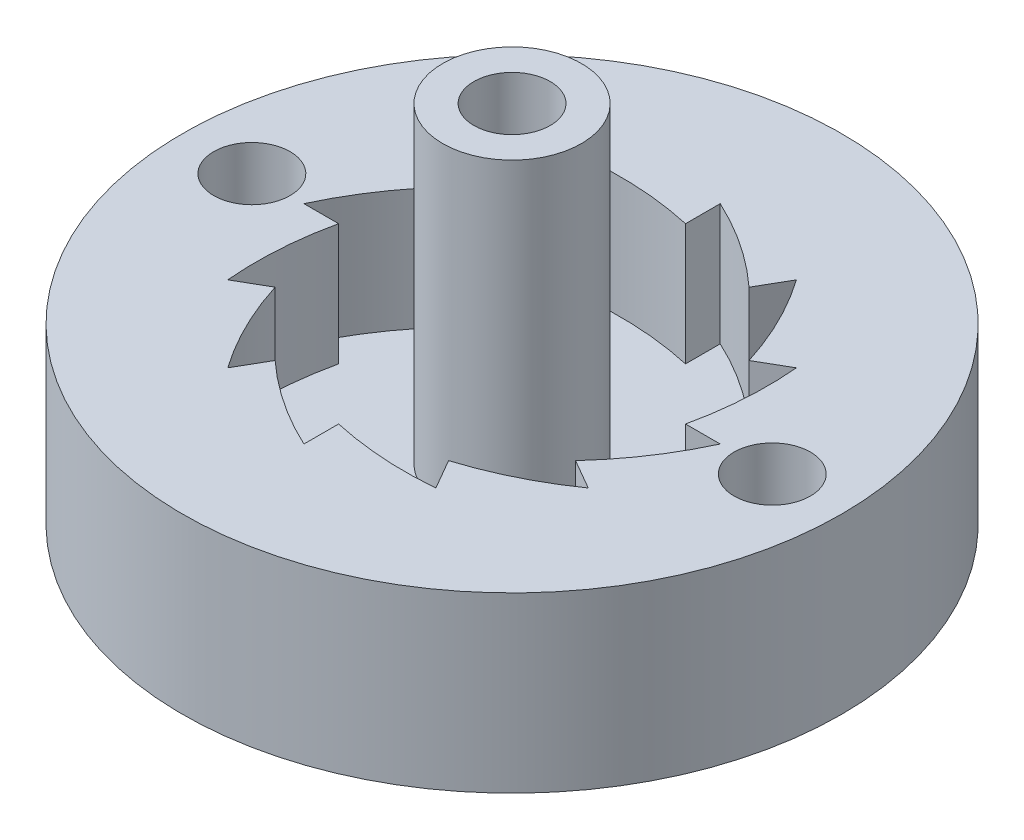
from build123d import *

# Parameters (mm, degrees)
SIDE_PROFILE_RATCHETING_PULLEY_MASTERMOD_W = 7.5
SIDE_PROFILE_RATCHETING_PULLEY_MASTERMOD_H = 5
RATCHETING_START                           = 1.5
RATCHETING_PULLEY_MASTERMODEL_OUTLINE_R    = 6
RATCHETING_PULLEY_MASTERMODEL_OUTLINE_R_2  = 2
RATCHETING_PULLEY_MASTERMODEL_DEPTH        = 3.5
M2_CLEARANCE_HOLE2_D                       = 2.2
BOSS_EXTRUDE2_DEPTH                        = 5
BOSS_EXTRUDE1_START                        = 10.5
BOTTOM_PULLEY_RATCHETING_PULLEY_MASTERMO_R = 2
BOSS_EXTRUDE1_DEPTH                        = 10.5
M2_CLEARANCE_HOLE3_D                       = 2.2
BOTTOM_PULLEY_RATCHETING_PULLEY_MAST_2_R   = 4
CUT_EXTRUDE3_DEPTH                         = 1


# Read off the part's stored shape, not the designer's step: ratcheting pulley mastermodel
with BuildPart() as part:
    # side profile-ratcheting pulley mastermod → Revolve1 (revolve)
    with BuildSketch(Plane.XY, mode=Mode.PRIVATE) as revolve1_sk:
        with Locations((-5.75, 2.5)):
            Rectangle(SIDE_PROFILE_RATCHETING_PULLEY_MASTERMOD_W, SIDE_PROFILE_RATCHETING_PULLEY_MASTERMOD_H)
        with Locations((5.75, 2.5)):
            Rectangle(SIDE_PROFILE_RATCHETING_PULLEY_MASTERMOD_W, SIDE_PROFILE_RATCHETING_PULLEY_MASTERMOD_H)
    revolve(revolve1_sk.sketch.rotate(Axis((0, 0, 0), (0, 1, 0)), 180), axis=Axis((0, 0, 0), (0, 1, 0)))

    # ratcheting pulley mastermodel outline → ratcheting pulley mastermodel (cut)
    with BuildSketch(Plane(origin=(0, 0, 0), x_dir=(1, 0, 0), z_dir=(0, 1, 0)).offset(RATCHETING_START)):
        Circle(RATCHETING_PULLEY_MASTERMODEL_OUTLINE_R)
        Circle(RATCHETING_PULLEY_MASTERMODEL_OUTLINE_R_2, mode=Mode.SUBTRACT)
    extrude(amount=RATCHETING_PULLEY_MASTERMODEL_DEPTH, mode=Mode.SUBTRACT)

    # M2 Clearance Hole2 (through all)
    with Locations(Plane(origin=(0, 0, 0), x_dir=(-1, 0, 0), z_dir=(0, -1, 0))):
        with Locations((-7.5, 0), (7.5, 0)):
            Hole(M2_CLEARANCE_HOLE2_D / 2)

    # ratchet profile-ratcheting pulley master → Boss-Extrude2 (add)
    with BuildSketch(Plane(origin=(0, 0, 0), x_dir=(1, 0, 0), z_dir=(0, 1, 0))):
        with BuildLine():
            ThreePointArc((-3, 5.196152423), (-1.492401284, 5.214292716), (0, 5))
            Line((0, 5), (0, 6))
            ThreePointArc((0, 6), (-1.552914271, 5.795554958), (-3, 5.196152423))
        make_face()
        with BuildLine():
            ThreePointArc((0, 6), (1.314688934, 5.261910597), (2.5, 4.330127019))
            Line((2.5, 4.330127019), (3, 5.196152423))
            ThreePointArc((3, 5.196152423), (1.552914271, 5.795554958), (0, 6))
        make_face()
        with BuildLine():
            ThreePointArc((3, 5.196152423), (3.769509313, 3.899603782), (4.330127019, 2.5))
            Line((4.330127019, 2.5), (5.196152423, 3))
            ThreePointArc((5.196152423, 3), (4.242640687, 4.242640687), (3, 5.196152423))
        make_face()
        with BuildLine():
            ThreePointArc((5.196152423, 3), (5.214292716, 1.492401284), (5, 0))
            Line((5, 0), (6, 0))
            ThreePointArc((6, 0), (5.795554958, 1.552914271), (5.196152423, 3))
        make_face()
        with BuildLine():
            ThreePointArc((6, 0), (5.261910597, -1.314688934), (4.330127019, -2.5))
            Line((4.330127019, -2.5), (5.196152423, -3))
            ThreePointArc((5.196152423, -3), (5.795554958, -1.552914271), (6, 0))
        make_face()
        with BuildLine():
            ThreePointArc((5.196152423, -3), (3.899603782, -3.769509313), (2.5, -4.330127019))
            Line((2.5, -4.330127019), (3, -5.196152423))
            ThreePointArc((3, -5.196152423), (4.242640687, -4.242640687), (5.196152423, -3))
        make_face()
        with BuildLine():
            ThreePointArc((3, -5.196152423), (1.492401284, -5.214292716), (0, -5))
            Line((0, -5), (0, -6))
            ThreePointArc((0, -6), (1.552914271, -5.795554958), (3, -5.196152423))
        make_face()
        with BuildLine():
            ThreePointArc((0, -6), (-1.314688934, -5.261910597), (-2.5, -4.330127019))
            Line((-2.5, -4.330127019), (-3, -5.196152423))
            ThreePointArc((-3, -5.196152423), (-1.552914271, -5.795554958), (0, -6))
        make_face()
        with BuildLine():
            ThreePointArc((-3, -5.196152423), (-3.769509313, -3.899603782), (-4.330127019, -2.5))
            Line((-4.330127019, -2.5), (-5.196152423, -3))
            ThreePointArc((-5.196152423, -3), (-4.242640687, -4.242640687), (-3, -5.196152423))
        make_face()
        with BuildLine():
            ThreePointArc((-5.196152423, -3), (-5.214292716, -1.492401284), (-5, 0))
            Line((-5, 0), (-6, 0))
            ThreePointArc((-6, 0), (-5.795554958, -1.552914271), (-5.196152423, -3))
        make_face()
        with BuildLine():
            ThreePointArc((-6, 0), (-5.261910597, 1.314688934), (-4.330127019, 2.5))
            Line((-4.330127019, 2.5), (-5.196152423, 3))
            ThreePointArc((-5.196152423, 3), (-5.795554958, 1.552914271), (-6, 0))
        make_face()
        with BuildLine():
            ThreePointArc((-5.196152423, 3), (-3.899603782, 3.769509313), (-2.5, 4.330127019))
            Line((-2.5, 4.330127019), (-3, 5.196152423))
            ThreePointArc((-3, 5.196152423), (-4.242640687, 4.242640687), (-5.196152423, 3))
        make_face()
    extrude(amount=BOSS_EXTRUDE2_DEPTH)

    # bottom pulley-ratcheting pulley mastermo → Boss-Extrude1 (add)
    with BuildSketch(Plane(origin=(0, 0, 0), x_dir=(1, 0, 0), z_dir=(0, 1, 0)).offset(BOSS_EXTRUDE1_START)):
        with Locations(Location((0, 0, 0), (0, 0, 270))):
            Circle(BOTTOM_PULLEY_RATCHETING_PULLEY_MASTERMO_R)
    extrude(amount=-BOSS_EXTRUDE1_DEPTH)

    # M2 Clearance Hole3 (through all)
    with Locations(Plane(origin=(0, 10.5, 0), x_dir=(1, 0, 0), z_dir=(0, 1, 0))):
        with Locations((0, 0)):
            Hole(M2_CLEARANCE_HOLE3_D / 2)

    # bottom pulley-ratcheting pulley mast 2 → Cut-Extrude3 (cut)
    with BuildSketch(Plane(origin=(0, 0, 0), x_dir=(1, 0, 0), z_dir=(0, 1, 0))):
        with Locations(Location((0, 0, 0), (0, 0, 270))):
            Circle(BOTTOM_PULLEY_RATCHETING_PULLEY_MAST_2_R)
    extrude(amount=CUT_EXTRUDE3_DEPTH, mode=Mode.SUBTRACT)


solid = part.part
